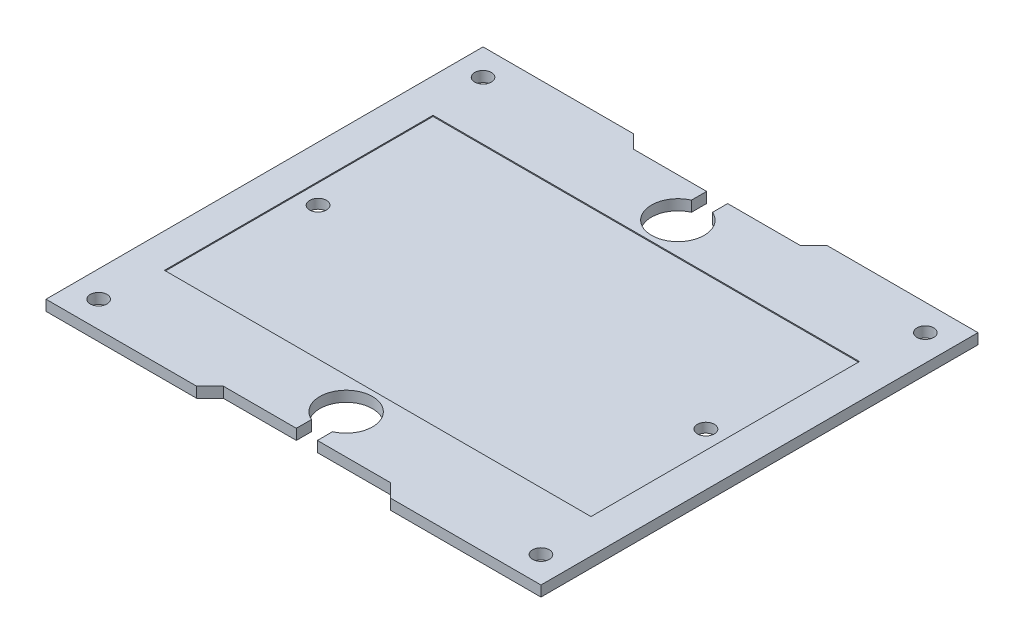
from build123d import *

# Parameters (mm, degrees)
SKETCH1_W           = 94
SKETCH1_H           = 83
SKETCH1_R           = 1.5875
BOSS_EXTRUDE1_DEPTH = 2
SKETCH2_W           = 81
SKETCH2_H           = 51
CUT_EXTRUDE1_DEPTH  = 0.2
SKETCH3_R           = 1.6
CUT_EXTRUDE2_DEPTH  = 63.731570999


with BuildPart() as part:
    # Sketch1 → Boss-Extrude1 (new body)
    with BuildSketch(Plane(origin=(0, 0, 0), x_dir=(1, 0, 0), z_dir=(0, 1, 0))):
        Rectangle(SKETCH1_W, SKETCH1_H)
        with Locations((-42, 36.5)):
            Circle(SKETCH1_R, mode=Mode.SUBTRACT)
        with Locations((42, 36.5)):
            Circle(SKETCH1_R, mode=Mode.SUBTRACT)
        with Locations((42, -36.5)):
            Circle(SKETCH1_R, mode=Mode.SUBTRACT)
        with Locations((-42, -36.5)):
            Circle(SKETCH1_R, mode=Mode.SUBTRACT)
    extrude(amount=BOSS_EXTRUDE1_DEPTH)

    # Sketch2 → Cut-Extrude1 (cut)
    with BuildSketch(Plane(origin=(0, 2, 0), x_dir=(1, 0, 0), z_dir=(0, 1, 0))):
        Rectangle(SKETCH2_W, SKETCH2_H)
    extrude(amount=-CUT_EXTRUDE1_DEPTH, mode=Mode.SUBTRACT)

    # Sketch3 → Cut-Extrude2 (cut, through all)
    with BuildSketch(Plane(origin=(0, 2, 0), x_dir=(1, 0, 0), z_dir=(0, 1, 0))):
        with BuildLine():
            Line((18.415, 41.5), (-18.415, 41.5))
            Line((-18.415, 41.5), (-15.875, 38.96))
            Line((-15.875, 38.96), (-2, 38.96))
            Line((-2, 38.96), (-2, 36.082575695))
            ThreePointArc((-2, 36.082575695), (0, 26.5), (2, 36.082575695))
            Line((2, 36.082575695), (2, 38.96))
            Line((2, 38.96), (15.875, 38.96))
            Line((15.875, 38.96), (18.415, 41.5))
        make_face()
        with BuildLine():
            Line((-18.415, -41.5), (18.415, -41.5))
            Line((18.415, -41.5), (15.875, -38.96))
            Line((15.875, -38.96), (2, -38.96))
            Line((2, -38.96), (2, -36.082575695))
            ThreePointArc((2, -36.082575695), (0, -26.5), (-2, -36.082575695))
            Line((-2, -36.082575695), (-2, -38.96))
            Line((-2, -38.96), (-15.875, -38.96))
            Line((-15.875, -38.96), (-18.415, -41.5))
        make_face()
        with Locations((-36.83, 0)):
            Circle(SKETCH3_R)
        with Locations((36.83, 0)):
            Circle(SKETCH3_R)
    extrude(amount=-CUT_EXTRUDE2_DEPTH, mode=Mode.SUBTRACT)


solid = part.part
